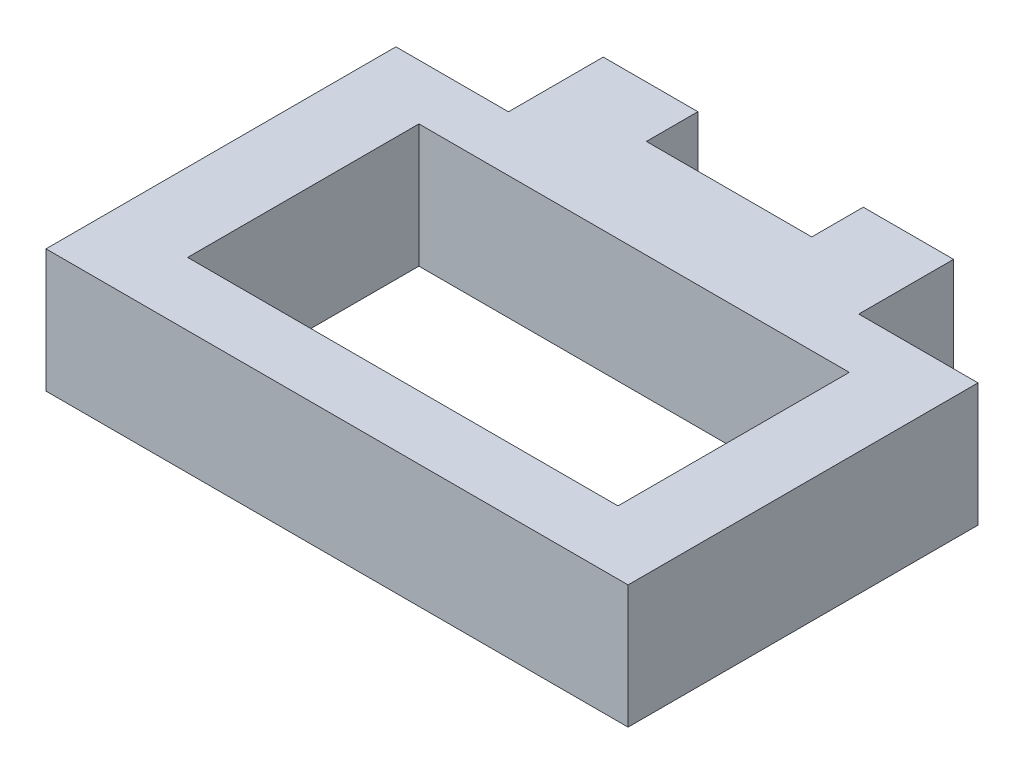
from build123d import *

# Parameters (mm, degrees)
SKETCH1_W           = 22.7
SKETCH1_H           = 12.2
BOSS_EXTRUDE5_DEPTH = 6.5


with BuildPart() as part:
    # Sketch1 → Boss-Extrude5 (new body)
    with BuildSketch(Plane(origin=(0, 0, 0), x_dir=(1, 0, 0), z_dir=(0, 1, 0))):
        Polygon((23.208363186, 32.900104101), (23.208363186, 35.61697891), (18.217441835, 35.61697891), (18.217441835, 30.61697891), (12.281037655, 30.61697891), (12.281037655, 12.159890469), (42.983706025, 12.159890469), (42.983706025, 30.61697891), (36.695280427, 30.61697891), (36.695280427, 35.61697891), (31.932950893, 35.61697891), (31.932950893, 32.900104101), align=None)
        with Locations((27.758406256, 21.602944359)):
            Rectangle(SKETCH1_W, SKETCH1_H, mode=Mode.SUBTRACT)
    extrude(amount=BOSS_EXTRUDE5_DEPTH)


solid = part.part
